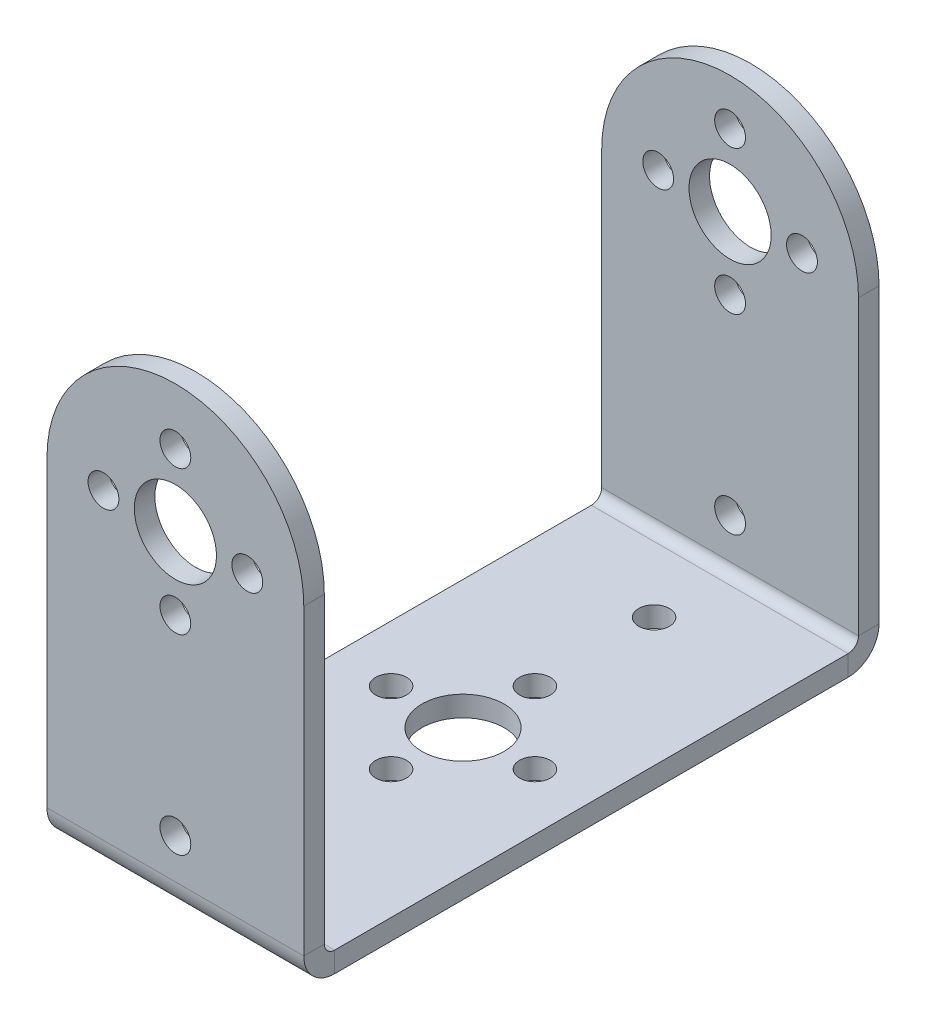
from build123d import *

# Parameters (mm, degrees)
BASE_FLANGE1_DEPTH           = 2
EDGE_FLANGE1_DEPTH           = 25
EDGE_FLANGE2_STRIP_W         = 10
EDGE_FLANGE2_STRIP_H         = 2
EDGE_FLANGE2_STRIP_CUT_DEPTH = 25
EDGE_FLANGE2_DEPTH           = 25
CUT_EXTRUDE1_DEPTH           = 2
SKETCH19_R                   = 4
CUT_EXTRUDE2_DEPTH           = 72.107313267
M3X0_5_TAPPED_HOLE1_D        = 3
SKETCH22_R                   = 4
CUT_EXTRUDE3_DEPTH           = 72.702510416
M3X0_5_TAPPED_HOLE2_D        = 3


# Sheet-metal steps are written as plain solids
with BuildPart() as part:
    # Sketch8 → Base-Flange1 (new body)
    with BuildSketch(Plane.XY):
        with BuildLine():
            Line((-12.5, 0), (12.5, 0))
            Line((12.5, 0), (12.5, 29.5))
            ThreePointArc((12.5, 29.5), (0, 42), (-12.5, 29.5))
            Line((-12.5, 29.5), (-12.5, 0))
        make_face()
    extrude(amount=-BASE_FLANGE1_DEPTH)

    # Edge-Flange1 section (across the edge) → Edge-Flange1 (add)
    with BuildSketch(Plane(origin=(12.5, -1, -2), x_dir=(0, 1, 0), z_dir=(-1, 0, 0))):
        with BuildLine():
            Line((-2, 1), (-2, 52))
            Line((-2, 52), (0, 52))
            Line((0, 52), (0, 1))
            ThreePointArc((0, 1), (0.292893219, 0.292893219), (1, 0))
            Line((1, 0), (1, -2))
            ThreePointArc((1, -2), (-1.121320344, -1.121320344), (-2, 1))
        make_face()
    extrude(amount=EDGE_FLANGE1_DEPTH)

    # Edge-Flange2 strip (across the edge) → Edge-Flange2 strip cut (cut)
    with BuildSketch(Plane(origin=(12.5, -1, -54), x_dir=(0, 0, 1), z_dir=(-1, 0, 0))):
        with Locations((-4, -1)):
            Rectangle(EDGE_FLANGE2_STRIP_W, EDGE_FLANGE2_STRIP_H)
    extrude(amount=EDGE_FLANGE2_STRIP_CUT_DEPTH, mode=Mode.SUBTRACT)

    # Edge-Flange2 section (across the edge) → Edge-Flange2 (add)
    with BuildSketch(Plane(origin=(12.5, -1, -54), x_dir=(0, 0, 1), z_dir=(-1, 0, 0))):
        with BuildLine():
            Line((-2, 1), (-2, 42))
            Line((-2, 42), (0, 42))
            Line((0, 42), (0, 1))
            ThreePointArc((0, 1), (0.292893219, 0.292893219), (1, 0))
            Line((1, 0), (1, -2))
            ThreePointArc((1, -2), (-1.121320344, -1.121320344), (-2, 1))
        make_face()
    extrude(amount=EDGE_FLANGE2_DEPTH)

    # Sketch18 → Cut-Extrude1 (cut)
    with BuildSketch(Plane(origin=(0, 0, -56), x_dir=(-1, 0, 0), z_dir=(0, 0, -1))):
        with BuildLine():
            ThreePointArc((2e-08, 41), (8.838834772, 37.338834758), (12.5, 28.5))
            Line((12.5, 28.5), (12.5, 41))
            Line((12.5, 41), (2e-08, 41))
        make_face()
        with BuildLine():
            ThreePointArc((-12.5, 28.5), (-8.838834758, 37.338834772), (2e-08, 41))
            Line((2e-08, 41), (-12.5, 41))
            Line((-12.5, 41), (-12.5, 28.5))
        make_face()
    extrude(amount=-CUT_EXTRUDE1_DEPTH, mode=Mode.SUBTRACT)

    # Sketch19 → Cut-Extrude2 (cut, through all)
    with BuildSketch(Plane.XY):
        with Locations((0, 29.5)):
            Circle(SKETCH19_R)
    extrude(amount=-CUT_EXTRUDE2_DEPTH, mode=Mode.SUBTRACT)

    # M3x0.5 Tapped Hole1 (through all)
    with Locations(Plane.XY):
        with Locations((0, 36.5), (-7, 29.5), (0, 22.5), (7, 29.5), (0, 3.9), (0, -12.97)):
            Hole(M3X0_5_TAPPED_HOLE1_D / 2)

    # Sketch22 → Cut-Extrude3 (cut, through all)
    with BuildSketch(Plane(origin=(0, -1, 0), x_dir=(1, 0, 0), z_dir=(0, 1, 0))):
        with Locations(Location((0, 28, 0), (0, 0, 270))):
            Circle(SKETCH22_R)
    extrude(amount=-CUT_EXTRUDE3_DEPTH, mode=Mode.SUBTRACT)

    # M3x0.5 Tapped Hole2 (through all)
    with Locations(Plane(origin=(0, -1, 0), x_dir=(1, 0, 0), z_dir=(0, 1, 0))):
        with Locations((7, 28), (-7, 28), (0, 35), (0, 21), (0, 9.4), (0, 46.6)):
            Hole(M3X0_5_TAPPED_HOLE2_D / 2)


solid = part.part
